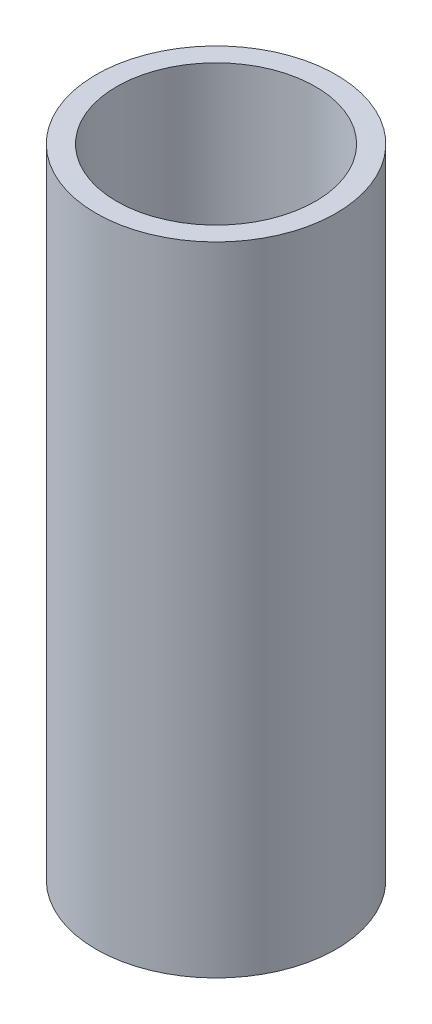
from build123d import *

# Parameters (mm, degrees)
SKETCH1_R           = 52.5
BOSS_EXTRUDE1_DEPTH = 278.736227608
SKETCH2_R           = 43.471990641
CUT_EXTRUDE1_DEPTH  = 289.455169101


with BuildPart() as part:
    # Sketch1 → Boss-Extrude1 (new body)
    with BuildSketch(Plane(origin=(0, 0, 0), x_dir=(1, 0, 0), z_dir=(0, 1, 0))):
        Circle(SKETCH1_R)
    extrude(amount=BOSS_EXTRUDE1_DEPTH)

    # Sketch2 → Cut-Extrude1 (cut, through all)
    with BuildSketch(Plane(origin=(0, 0, 0), x_dir=(1, 0, 0), z_dir=(0, 1, 0))):
        Circle(SKETCH2_R)
    extrude(amount=CUT_EXTRUDE1_DEPTH, mode=Mode.SUBTRACT)


solid = part.part
